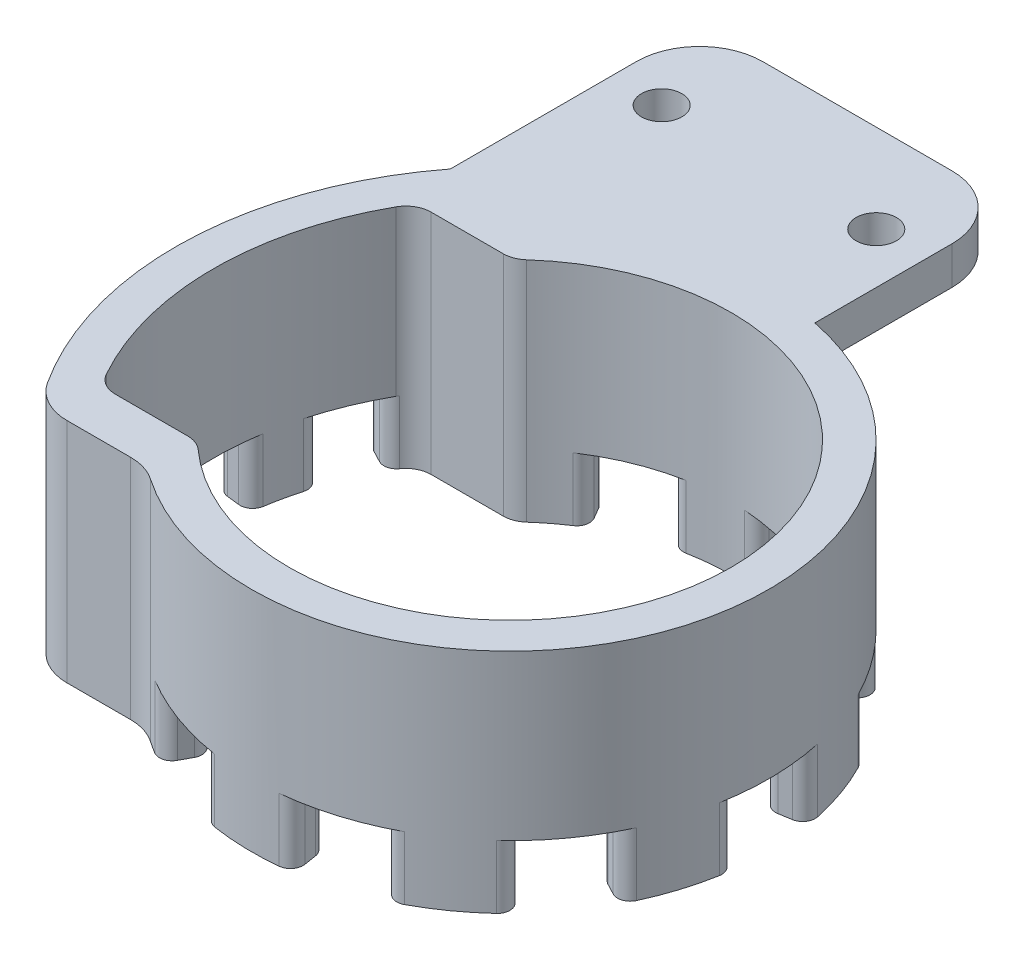
from build123d import *

# Parameters (mm, degrees)
BOSS_EXTRUDE1_DEPTH      = 18
BOSS_EXTRUDE2_START      = -3
BOSS_EXTRUDE2_DEPTH      = 3
SKETCH3_R                = 1.6
CUT_EXTRUDE1_DEPTH       = 49.160828036
FILLET1_R                = 2
FILLET2_R                = 4
FILLET3_R                = 2
FILLET4_R                = 5
CUT_EXTRUDE2_DEPTH       = 5
FILLET5_R                = 1
CIRPATTERN1_COUNT        = 7
CIRPATTERN1_ANGLE        = 222
FILLET5_OF_CIRPATTERN1_R = 1
CUT_EXTRUDE3_DEPTH       = 5
FILLET6_R                = 1
CIRPATTERN2_COUNT        = 3
CIRPATTERN2_ANGLE        = 42
FILLET6_OF_CIRPATTERN2_R = 1


with BuildPart() as part:
    # Sketch1 → Boss-Extrude1 (new body)
    with BuildSketch(Plane(origin=(0, 0, 0), x_dir=(1, 0, 0), z_dir=(0, 1, 0))):
        with BuildLine():
            Line((-20.956684691, 16.219351614), (-12.537249827, 16.219351614))
            ThreePointArc((-12.537249827, 16.219351614), (20.5, 0), (-12.537249827, -16.219351614))
            Line((-12.537249827, -16.219351614), (-20.956684691, -16.219351614))
            ThreePointArc((-20.956684691, -16.219351614), (-26.5, 0), (-20.956684691, 16.219351614))
        make_face()
        with BuildLine():
            Line((-12.247448714, 12.5), (-19.899748742, 12.5))
            ThreePointArc((-19.899748742, 12.5), (-23.5, 0), (-19.899748742, -12.5))
            Line((-19.899748742, -12.5), (-12.247448714, -12.5))
            ThreePointArc((-12.247448714, -12.5), (17.5, 0), (-12.247448714, 12.5))
        make_face(mode=Mode.SUBTRACT)
    extrude(amount=BOSS_EXTRUDE1_DEPTH)

    # Sketch2 → Boss-Extrude2 (add)
    with BuildSketch(Plane(origin=(0, 18, 0), x_dir=(1, 0, 0), z_dir=(0, 1, 0)).offset(BOSS_EXTRUDE2_START)):
        with BuildLine():
            Line((-20.956684691, 16.219351614), (-20.956684691, 35.961303608))
            Line((-20.956684691, 35.961303608), (4.043315309, 35.961303608))
            Line((4.043315309, 35.961303608), (4.043315309, 20.097303334))
            ThreePointArc((4.043315309, 20.097303334), (-4.668657011, 19.961303608), (-12.537249827, 16.219351614))
            Line((-12.537249827, 16.219351614), (-20.956684691, 16.219351614))
        make_face()
    extrude(amount=BOSS_EXTRUDE2_DEPTH)

    # Sketch3 → Cut-Extrude1 (cut, through all)
    with BuildSketch(Plane(origin=(0, 18, 0), x_dir=(1, 0, 0), z_dir=(0, 1, 0))):
        with Locations(Location((-16.956684691, 28.961303608, 0), (0, 0, 270))):
            Circle(SKETCH3_R)
        with Locations(Location((0.043315309, 28.961303608, 0), (0, 0, 270))):
            Circle(SKETCH3_R)
    extrude(amount=-CUT_EXTRUDE1_DEPTH, mode=Mode.SUBTRACT)

    # Fillet1
    fillet1_edges = [part.edges().sort_by_distance(p)[0] for p in [
        (-12.247448714, 9, 12.5),
        (-12.247448714, 9, -12.5),
        (-19.899748742, 9, -12.5),
        (-19.899748742, 9, 12.5),
    ]]
    fillet(fillet1_edges, radius=FILLET1_R)

    # Fillet2
    fillet2_edges = [part.edges().sort_by_distance(p)[0] for p in [
        (-20.956684691, 7.5, -16.219351614),
        (-12.537249827, 7.5, -16.219351614),
        (-12.537249827, 9, 16.219351614),
        (-20.956684691, 9, 16.219351614),
    ]]
    fillet(fillet2_edges, radius=FILLET2_R)

    # Fillet3
    # the kernel refuses this fillet: 2 mm, written as the material it adds along each edge
    with BuildSketch(Plane(origin=(-18.892788204, 15, -12.219351614), x_dir=(-0.7800199921709761, 0, 0.6257545939212836), z_dir=(0.6257545939212836, 0, 0.7800199921709761))) as fillet3_piece_1_section:
        with BuildLine():
            CenterArc((4 + FILLET3_R, FILLET3_R), FILLET3_R, 180, 90)
            Line((4 + FILLET3_R, 0), (4, 0))
            Line((4, 0), (4, FILLET3_R))
        make_face()
    fillet3_piece_1 = revolve(axis=Axis((-18.892788204, 15, -12.219351614), (0, -1, 0)), revolution_arc=128.737594097, mode=Mode.PRIVATE)
    fillet3_piece_1 = fillet3_piece_1 & Plane(origin=(0, 14.307087346, 0), x_dir=(-0.7908182902157775, 0, 0.6120510042963694), z_dir=(0, -1, 0)) * Cylinder(26.5, 24, mode=Mode.PRIVATE)
    add(fillet3_piece_1)
    with BuildSketch(Plane(origin=(-18.892788204, 15, -12.219351614), x_dir=(-0.7800199921709761, 0, 0.6257545939212836), z_dir=(0.6257545939212836, 0, 0.7800199921709761))) as fillet3_piece_2_section:
        with BuildLine():
            CenterArc((4 + FILLET3_R, FILLET3_R), FILLET3_R, 180, 90)
            Line((4 + FILLET3_R, 0), (4, 0))
            Line((4, 0), (4, FILLET3_R))
        make_face()
    fillet3_piece_2 = revolve(axis=Axis((-18.892788204, 15, -12.219351614), (0, -1, 0)), revolution_arc=128.737594097, mode=Mode.PRIVATE)
    fillet3_piece_2 = split(fillet3_piece_2, bisect_by=Plane(origin=(-20.956684691, 14.868636222, -16.97413776), z_dir=(1, 0, 0)), keep=Keep.TOP, mode=Mode.PRIVATE)
    add(fillet3_piece_2)
    with BuildSketch(Plane(origin=(-13.835744299, 15, -16.219351614), x_dir=(0, -1, 0), z_dir=(-1, 0, 0))) as fillet3_piece_3:
        with BuildLine():
            CenterArc((FILLET3_R, -FILLET3_R), FILLET3_R, 90, 90)
            Line((0, -FILLET3_R), (0, 0))
            Line((0, 0), (FILLET3_R, 0))
        make_face()
    extrude(amount=5.057043905)
    with BuildSketch(Plane(origin=(-13.835744299, 15, -20.219351614), x_dir=(0, 0, 1), z_dir=(-1, 0, 0))) as fillet3_piece_4:
        with BuildLine():
            CenterArc((4 - FILLET3_R, -FILLET3_R), FILLET3_R, 0, 90)
            Line((4 - FILLET3_R, 0), (4, 0))
            Line((4, 0), (4, -FILLET3_R))
        make_face()
    revolve(axis=Axis((-13.835744299, 15, -20.219351614), (0, 1, 0)), revolution_arc=34.383145423)
    with BuildSketch(Plane(origin=(0, 15, 0), x_dir=(0.42816780762581996, 0, -0.9036992467148011), z_dir=(0.9036992467148011, 0, 0.42816780762581996))) as fillet3_piece_5_section:
        with BuildLine():
            CenterArc((20.5 + FILLET3_R, -FILLET3_R), FILLET3_R, 90, 90)
            Line((20.5 + FILLET3_R, 0), (20.5, 0))
            Line((20.5, 0), (20.5, -FILLET3_R))
        make_face()
    fillet3_piece_5 = revolve(axis=Axis((0, 15, 0), (0, 1, 0)), revolution_arc=59.734486114, mode=Mode.PRIVATE)
    fillet3_piece_5 = split(fillet3_piece_5, bisect_by=Plane(origin=(4.043315309, 14.430830573, -20.645912342), z_dir=(-1, 0, 0)), keep=Keep.TOP, mode=Mode.PRIVATE)
    add(fillet3_piece_5)

    # Fillet4
    fillet4_edges = [part.edges().sort_by_distance(p)[0] for p in [
        (-20.956684691, 16.5, -35.961303608),
        (4.043315309, 16.5, -35.961303608),
    ]]
    fillet(fillet4_edges, radius=FILLET4_R)

    # Sketch4 → Cut-Extrude2 (cut)
    with BuildSketch(Plane.XZ):
        with BuildLine():
            Line((-10.327391218, -17.708613459), (-8.816065674, -15.11710905))
            ThreePointArc((-8.816065674, -15.11710905), (-6.56605509, -16.221495633), (-4.181352636, -16.99312479))
            Line((-4.181352636, -16.99312479), (-4.898155945, -19.906231897))
            ThreePointArc((-4.898155945, -19.906231897), (-7.691664534, -19.002323455), (-10.327391218, -17.708613459))
        make_face()
    cut_extrude2 = extrude(amount=-CUT_EXTRUDE2_DEPTH, mode=Mode.SUBTRACT)

    # Fillet5
    fillet5_edges = [part.edges().sort_by_distance(p)[0] for p in [
        (-4.898155945, 2.5, -19.906231897),
        (-10.327391218, 2.5, -17.708613459),
        (-8.816065674, 2.5, -15.11710905),
        (-4.181352636, 2.5, -16.99312479),
    ]]
    fillet(fillet5_edges, radius=FILLET5_R)

    # CirPattern1: Cut-Extrude2 ×7 about axis
    cirpattern1_axis = Axis((0, 0, 0), (0, -1, 0))
    for i in range(1, CIRPATTERN1_COUNT):
        add(cut_extrude2.rotate(cirpattern1_axis, i * CIRPATTERN1_ANGLE / (CIRPATTERN1_COUNT - 1)), mode=Mode.SUBTRACT)

    # Fillet5 of CirPattern1
    fillet5_of_cirpattern1_edges = [part.edges().sort_by_distance(p)[0] for p in [
        (8.068028139, 2.5, -18.845607497),
        (2.409488266, 2.5, -20.357906727),
        (2.056880227, 2.5, -17.378700864),
        (6.887341094, 2.5, -16.087713717),
        (17.78498348, 2.5, -10.195310815),
        (14.175996999, 2.5, -14.808480985),
        (12.101460852, 2.5, -12.641386207),
        (15.182302971, 2.5, -8.70331411),
        (20.339410567, 2.5, 2.560932992),
        (20.23342092, 2.5, -3.295250803),
        (17.272432493, 2.5, -2.813018978),
        (17.36291146, 2.5, 2.186162311),
        (14.702567584, 2.5, 14.285814868),
        (18.142259875, 2.5, 9.545072374),
        (15.487295015, 2.5, 8.148232514),
        (12.550972328, 2.5, 12.195207814),
        (3.144574556, 2.5, 20.257385094),
        (8.744685017, 2.5, 18.541318291),
        (7.464975015, 2.5, 15.827954638),
        (2.684392914, 2.5, 17.292889715),
        (-9.679829775, 2.5, 18.070719286),
        (-4.174627918, 2.5, 20.070438006),
        (-3.563706759, 2.5, 17.133300737),
        (-8.26326932, 2.5, 15.426223781),
    ]]
    fillet(fillet5_of_cirpattern1_edges, radius=FILLET5_OF_CIRPATTERN1_R)

    # Sketch5 → Cut-Extrude3 (cut)
    with BuildSketch(Plane.XZ):
        with BuildLine():
            Line((-20.824298223, -10.890298596), (-23.482719273, -12.28054948))
            ThreePointArc((-23.482719273, -12.28054948), (-24.442674065, -10.237464752), (-25.225266465, -8.12009432))
            Line((-25.225266465, -8.12009432), (-22.369575922, -7.20083836))
            ThreePointArc((-22.369575922, -7.20083836), (-21.675578888, -9.078506478), (-20.824298223, -10.890298596))
        make_face()
    cut_extrude3 = extrude(amount=-CUT_EXTRUDE3_DEPTH, mode=Mode.SUBTRACT)

    # Fillet6
    # the kernel refuses this fillet: 1 mm, written as the material it takes off along each edge
    with BuildSketch(Plane(origin=(-22.369575922, -2.448958324, -7.20083836), x_dir=(-0.28692429499419836, 0, 0.9579532603118391), z_dir=(0, 1, 0))) as fillet6_piece_1:
        with BuildLine():
            CenterArc((0.979795982, -0.999791645), FILLET6_R, 91.169626537, 87.660746926)
            Line((-0.019995663, -0.979379229), (0, 0))
            ThreePointArc((0, 0), (0.479691783, -0.004896344), (0.959383566, 0))
        make_face()
    extrude(amount=7.448958324, mode=Mode.SUBTRACT)
    with BuildSketch(Plane(origin=(-20.824298223, -2.414717082, -10.890298596), x_dir=(-0.8861403499271628, 0, -0.4634169615270522), z_dir=(0, 1, 0))) as fillet6_piece_2:
        with BuildLine():
            CenterArc((0.965886833, -1), FILLET6_R, 90, 82.530423004)
            Line((-0.025627196, -0.870000265), (-0.124778599, -0.857000292))
            ThreePointArc((-0.124778599, -0.857000292), (-0.109420136, -0.663907842), (-0.1, 0))
            Line((-0.1, 0), (0, 0.1))
            Line((0, 0.1), (0.965886833, 0.1))
            Line((0.965886833, 0.1), (0.965886833, 0))
        make_face()
    extrude(amount=7.414717082, mode=Mode.SUBTRACT)
    with BuildSketch(Plane(origin=(-23.482719273, -2.598538983, -12.28054948), x_dir=(0.8861403499271632, 0, 0.4634169615270516), z_dir=(0, 1, 0))) as fillet6_piece_3:
        with BuildLine():
            CenterArc((1.019615388, 1), FILLET6_R, 177.752530382, 92.247469618)
            ThreePointArc((0.020384618, 1.039215686), (0.005096645, 0.519707797), (0, 0))
            Line((0, 0), (1.019615388, 0))
        make_face()
    extrude(amount=7.598538983, mode=Mode.SUBTRACT)
    with BuildSketch(Plane(origin=(-25.225266465, -2.598538983, -8.12009432), x_dir=(-0.28769148679844025, 0, 0.9577231376675114), z_dir=(0, 1, 0))) as fillet6_piece_4:
        with BuildLine():
            CenterArc((1.019803978, 0.999807674), FILLET6_R, 178.876265191, 92.247469618)
            Line((0.019996304, 1.019419289), (0, 0))
            ThreePointArc((0, 0), (0.519707797, -0.005096645), (1.039415593, 0))
        make_face()
    extrude(amount=7.598538983, mode=Mode.SUBTRACT)

    # CirPattern2: Cut-Extrude3 ×3 about axis
    cirpattern2_axis = Axis((0, -0.9, 0), (0, 1, 0))
    for i in range(1, CIRPATTERN2_COUNT):
        add(cut_extrude3.rotate(cirpattern2_axis, i * CIRPATTERN2_ANGLE / (CIRPATTERN2_COUNT - 1)), mode=Mode.SUBTRACT)

    # Fillet6 of CirPattern2
    # the kernel refuses this fillet: 1 mm, written as the material it takes off along each edge
    with BuildSketch(Plane(origin=(-23.464347908, -2.448958324, 1.293977308), x_dir=(0.07543283996510414, 0, 0.9971508845981129), z_dir=(0, 1, 0)), Plane(origin=(-21.442135932, -2.448958324, 9.616902134), x_dir=(0.42776954080722046, 0, 0.9038878359384973), z_dir=(0, 1, 0))) as fillet6_of_cirpattern2_piece_1:
        with BuildLine():
            CenterArc((0.979795982, -0.999791645), FILLET6_OF_CIRPATTERN2_R, 91.169626537, 87.660746926)
            Line((-0.019995663, -0.979379229), (0, 0))
            ThreePointArc((0, 0), (0.479691783, -0.004896344), (0.959383566, 0))
        make_face()
    extrude(amount=7.448958324, mode=Mode.SUBTRACT)
    with BuildSketch(Plane(origin=(-23.343891195, -2.448958324, -2.704208553), x_dir=(0.13532554648000364, 0, -0.9908011891746439), z_dir=(0, 1, 0)), Plane(origin=(-22.762501572, -2.448958324, 5.841106248), x_dir=(-0.22873410917279471, 0, -0.9734889353767346), z_dir=(0, 1, 0))) as fillet6_of_cirpattern2_piece_2:
        with BuildLine():
            CenterArc((0.979795982, 0.999791645), FILLET6_OF_CIRPATTERN2_R, 181.169626537, 87.660746926)
            Line((-0.019995663, 0.979379229), (0, 0))
            ThreePointArc((0, 0), (0.479691783, 0.004896344), (0.959383566, 0))
        make_face()
    extrude(amount=7.448958324, mode=Mode.SUBTRACT)
    with BuildSketch(Plane(origin=(-26.323962411, -2.598538983, -3.049426666), x_dir=(0.13453190929886197, 0, -0.9909092619308807), z_dir=(0, 1, 0)), Plane(origin=(-25.668352836, -2.598538983, 6.586779386), x_dir=(-0.22951376312290186, 0, -0.9733054158573065), z_dir=(0, 1, 0))) as fillet6_of_cirpattern2_piece_3:
        with BuildLine():
            CenterArc((1.019803978, -0.999807674), FILLET6_OF_CIRPATTERN2_R, 88.876265191, 92.247469618)
            Line((0.019996304, -1.019419289), (0, 0))
            ThreePointArc((0, 0), (0.519707797, 0.005096645), (1.039415593, 0))
        make_face()
    extrude(amount=7.598538983, mode=Mode.SUBTRACT)
    with BuildSketch(Plane(origin=(-26.459796577, -2.598538983, 1.459165901), x_dir=(0.07463413613309515, 0, 0.9972109835554694), z_dir=(0, 1, 0)), Plane(origin=(-24.179429881, -2.598538983, 10.844591769), x_dir=(0.4270454240832149, 0, 0.904230173003305), z_dir=(0, 1, 0))) as fillet6_of_cirpattern2_piece_4:
        with BuildLine():
            CenterArc((1.019803978, 0.999807674), FILLET6_OF_CIRPATTERN2_R, 178.876265191, 92.247469618)
            Line((0.019996304, 1.019419289), (0, 0))
            ThreePointArc((0, 0), (0.519707797, -0.005096645), (1.039415593, 0))
        make_face()
    extrude(amount=7.598538983, mode=Mode.SUBTRACT)


solid = part.part
